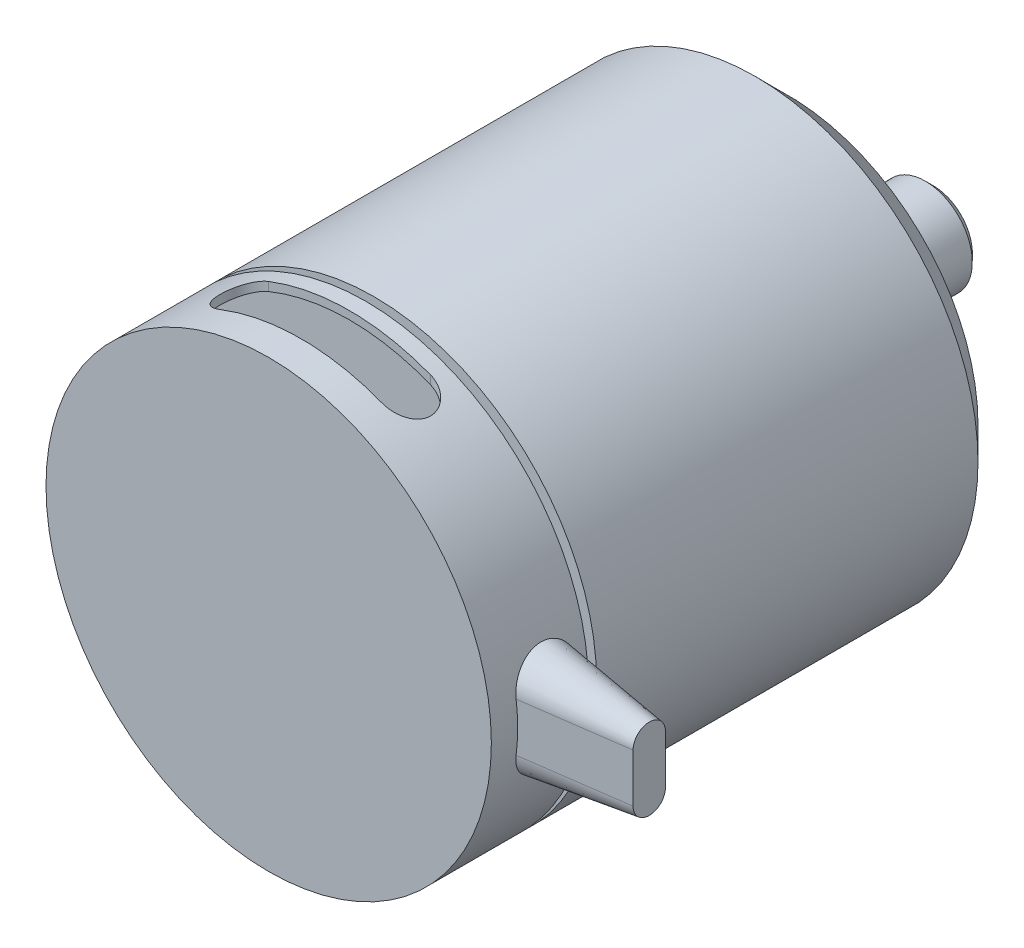
from build123d import *

# Parameters (mm, degrees)
SKETCH1_R           = 13.75
BOSS_EXTRUDE1_DEPTH = 6
SHELL1_T            = -0.5
SKETCH3_R           = 5
BOSS_EXTRUDE2_DEPTH = 6
BOSS_EXTRUDE7_START = 2
SKETCH10_R          = 13.25
BOSS_EXTRUDE7_DEPTH = 2
BOSS_EXTRUDE3_START = 25.55
SKETCH4_R           = 13.75
BOSS_EXTRUDE3_DEPTH = 25.55
CHAMFER1_SIZE       = 2
SKETCH5_R           = 3.9
BOSS_EXTRUDE4_DEPTH = 4.8
SKETCH6_R           = 2.9
BOSS_EXTRUDE5_DEPTH = 4.2
CHAMFER2_SIZE       = 0.5
CUT_EXTRUDE1_START  = -5
CUT_EXTRUDE1_DEPTH  = 24.2
CUT_EXTRUDE2_START  = -5
CUT_EXTRUDE2_DEPTH  = 24.2
BOSS_EXTRUDE8_DEPTH = 6.687218579
BOSS_EXTRUDE8_DRAFT = 8


# Read off the part's stored shape, not the designer's step: Boss-Extrude8
with BuildPart() as part:
    # Sketch1 → Boss-Extrude1 (new body)
    with BuildSketch(Plane.XY):
        Circle(SKETCH1_R)
    extrude(amount=BOSS_EXTRUDE1_DEPTH)

    # Shell1
    shell1_openings = [part.faces().sort_by_distance(p)[0] for p in [
        (0, 0, 0),
    ]]
    offset(amount=SHELL1_T, openings=shell1_openings, kind=Kind.INTERSECTION)

    # Sketch3 → Boss-Extrude2 (add)
    with BuildSketch(Plane(origin=(0, 0, 5.5), x_dir=(-1, 0, 0), z_dir=(0, 0, -1))):
        with Locations(Location((0, 0, 0), (0, 0, 180))):
            Circle(SKETCH3_R)
    extrude(amount=BOSS_EXTRUDE2_DEPTH)

    # Sketch10 → Boss-Extrude7 (add)
    with BuildSketch(Plane(origin=(0, 0, 5.5), x_dir=(-1, 0, 0), z_dir=(0, 0, -1)).offset(BOSS_EXTRUDE7_START)):
        Circle(SKETCH10_R)
    extrude(amount=-BOSS_EXTRUDE7_DEPTH)

    # Sketch4 → Boss-Extrude3 (add)
    with BuildSketch(Plane(origin=(0, 0, -0.5), x_dir=(-1, 0, 0), z_dir=(0, 0, -1)).offset(BOSS_EXTRUDE3_START)):
        with Locations(Location((0, 0, 0), (0, 0, 180))):
            Circle(SKETCH4_R)
    extrude(amount=-BOSS_EXTRUDE3_DEPTH)

    # Chamfer1
    chamfer1_edges = [part.edges().sort_by_distance(p)[0] for p in [
        (-13.75, 0, -26.05),
    ]]
    chamfer(chamfer1_edges, length=CHAMFER1_SIZE)

    # Sketch5 → Boss-Extrude4 (add)
    with BuildSketch(Plane(origin=(0, 0, -26.05), x_dir=(-1, 0, 0), z_dir=(0, 0, -1))):
        Circle(SKETCH5_R)
    extrude(amount=BOSS_EXTRUDE4_DEPTH)

    # Sketch6 → Boss-Extrude5 (add)
    with BuildSketch(Plane(origin=(0, 0, -30.85), x_dir=(-1, 0, 0), z_dir=(0, 0, -1))):
        Circle(SKETCH6_R)
    extrude(amount=BOSS_EXTRUDE5_DEPTH)

    # Chamfer2
    chamfer2_edges = [part.edges().sort_by_distance(p)[0] for p in [
        (2.9, 0, -35.05),
    ]]
    chamfer(chamfer2_edges, length=CHAMFER2_SIZE)

    # Sketch7 → Cut-Extrude1 (cut)
    with BuildSketch(Plane(origin=(0, 0, 0), x_dir=(0, 0, -1), z_dir=(1, 0, 0)).offset(CUT_EXTRUDE1_START)):
        with BuildLine():
            Line((-4, -5), (-4, 5))
            ThreePointArc((-4, 5), (-2.5, 6.5), (-1, 5))
            Line((-1, 5), (-1, -5))
            ThreePointArc((-1, -5), (-2.5, -6.5), (-4, -5))
        make_face()
    extrude(amount=-CUT_EXTRUDE1_DEPTH, mode=Mode.SUBTRACT)

    # Sketch8 → Cut-Extrude2 (cut)
    with BuildSketch(Plane(origin=(0, 0, 0), x_dir=(1, 0, 0), z_dir=(0, 1, 0)).offset(CUT_EXTRUDE2_START)):
        with BuildLine():
            Line((-5, -1), (5, -1))
            ThreePointArc((5, -1), (6.5, -2.5), (5, -4))
            Line((5, -4), (-5, -4))
            ThreePointArc((-5, -4), (-6.5, -2.5), (-5, -1))
        make_face()
    cut_extrude2 = extrude(amount=-CUT_EXTRUDE2_DEPTH, mode=Mode.SUBTRACT)

    # Mirror1: Cut-Extrude2 across plane
    add(cut_extrude2.mirror(Plane.ZX), mode=Mode.SUBTRACT)


with BuildPart() as boss_extrude8_tool:
    # Boss-Extrude8 outline → Boss-Extrude8 (with draft: the straight prism first)
    with BuildSketch(Plane(origin=(20, 0, 0), x_dir=(0, 0, -1), z_dir=(1, 0, 0))):
        with BuildLine():
            ThreePointArc((-3.5, -1.5), (-2.5, -2.5), (-1.5, -1.5))
            Line((-1.5, -1.5), (-1.5, 1.5))
            ThreePointArc((-1.5, 1.5), (-2.5, 2.5), (-3.5, 1.5))
            Line((-3.5, 1.5), (-3.5, -1.5))
        make_face()
    extrude(amount=-BOSS_EXTRUDE8_DEPTH)
    # Boss-Extrude8: the draft: its side faces are tilted about the plane it starts from
    boss_extrude8_sides = [boss_extrude8_tool.faces().sort_by_distance(p)[0] for p in [
        (16.656390711, 0, 3.5),
        (16.65639071, -2.5, 2.5),
        (16.656390711, 0, 1.5),
        (16.65639071, 2.5, 2.5),
    ]]
    draft(boss_extrude8_sides, Plane(origin=(20, 0, 0), x_dir=(0, 0, -1), z_dir=(1, 0, 0)), BOSS_EXTRUDE8_DRAFT)


with BuildPart() as part_1:
    add(part.part)

    # Boss-Extrude8: add boss_extrude8_tool
    add(boss_extrude8_tool.part)


solid = part_1.part
